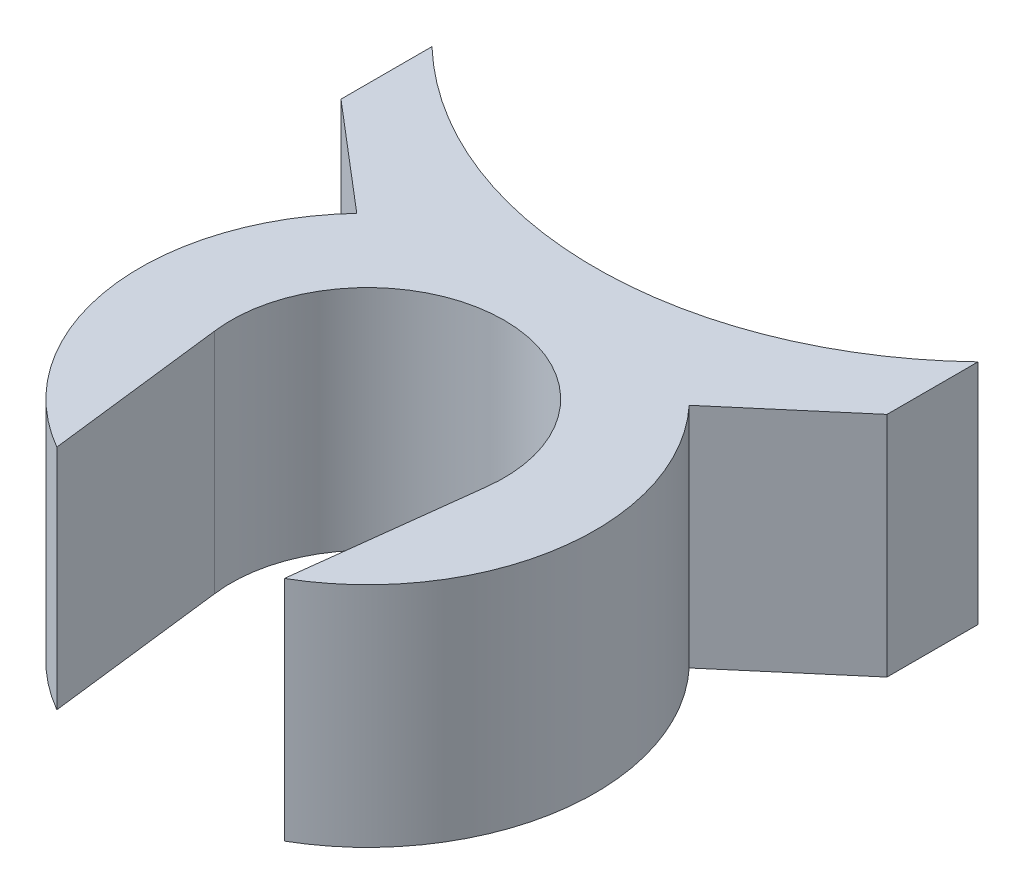
from build123d import *

# Parameters (mm, degrees)
CROQUIS1_R              = 3
SALIENTE_EXTRUIR1_DEPTH = 5
CORTAR_EXTRUIR1_START   = -10
CORTAR_EXTRUIR1_DEPTH   = 10
CORTAR_EXTRUIR2_DEPTH   = 10


with BuildPart() as part:
    # Croquis1 → Saliente-Extruir1 (new body)
    with BuildSketch(Plane(origin=(0, 0, 0), x_dir=(1, 0, 0), z_dir=(0, 1, 0))):
        with BuildLine():
            Line((-6, 7.413947971), (-6, 3.413947971))
            Line((-6, 3.413947971), (-3.653075314, 3.413947971))
            ThreePointArc((-3.653075314, 3.413947971), (0, -5), (3.653075314, 3.413947971))
            Line((3.653075314, 3.413947971), (6, 3.413947971))
            Line((6, 3.413947971), (6, 7.413947971))
            ThreePointArc((6, 7.413947971), (0, 5), (-6, 7.413947971))
        make_face()
        Circle(CROQUIS1_R, mode=Mode.SUBTRACT)
    extrude(amount=SALIENTE_EXTRUIR1_DEPTH)

    # Croquis2 → Cortar-Extruir1 (cut)
    with BuildSketch(Plane(origin=(0, 5, 0), x_dir=(1, 0, 0), z_dir=(0, 1, 0)).offset(CORTAR_EXTRUIR1_START)):
        with BuildLine():
            ThreePointArc((-2.5, -4.330127019), (-1.294095226, -4.829629131), (0, -5))
            ThreePointArc((0, -5), (1.294095226, -4.829629131), (2.5, -4.330127019))
            Line((2.5, -4.330127019), (2.981780701, -0.330127019))
            ThreePointArc((2.981780701, -0.330127019), (2.995441712, -0.165314693), (3, 0))
            ThreePointArc((3, 0), (-0.165314693, 2.995441712), (-2.981780701, -0.330127019))
            Line((-2.981780701, -0.330127019), (-2.5, -4.330127019))
        make_face()
    extrude(amount=CORTAR_EXTRUIR1_DEPTH, mode=Mode.SUBTRACT)

    # Croquis3 → Cortar-Extruir2 (cut)
    with BuildSketch(Plane(origin=(0, 5, 0), x_dir=(1, 0, 0), z_dir=(0, 1, 0))):
        Polygon((3.653075314, 3.413947971), (6, 5.413947971), (6, 3.413947971), align=None)
        Polygon((-3.653075314, 3.413947971), (-6, 5.413947971), (-6, 3.413947971), align=None)
    extrude(amount=-CORTAR_EXTRUIR2_DEPTH, mode=Mode.SUBTRACT)


solid = part.part
